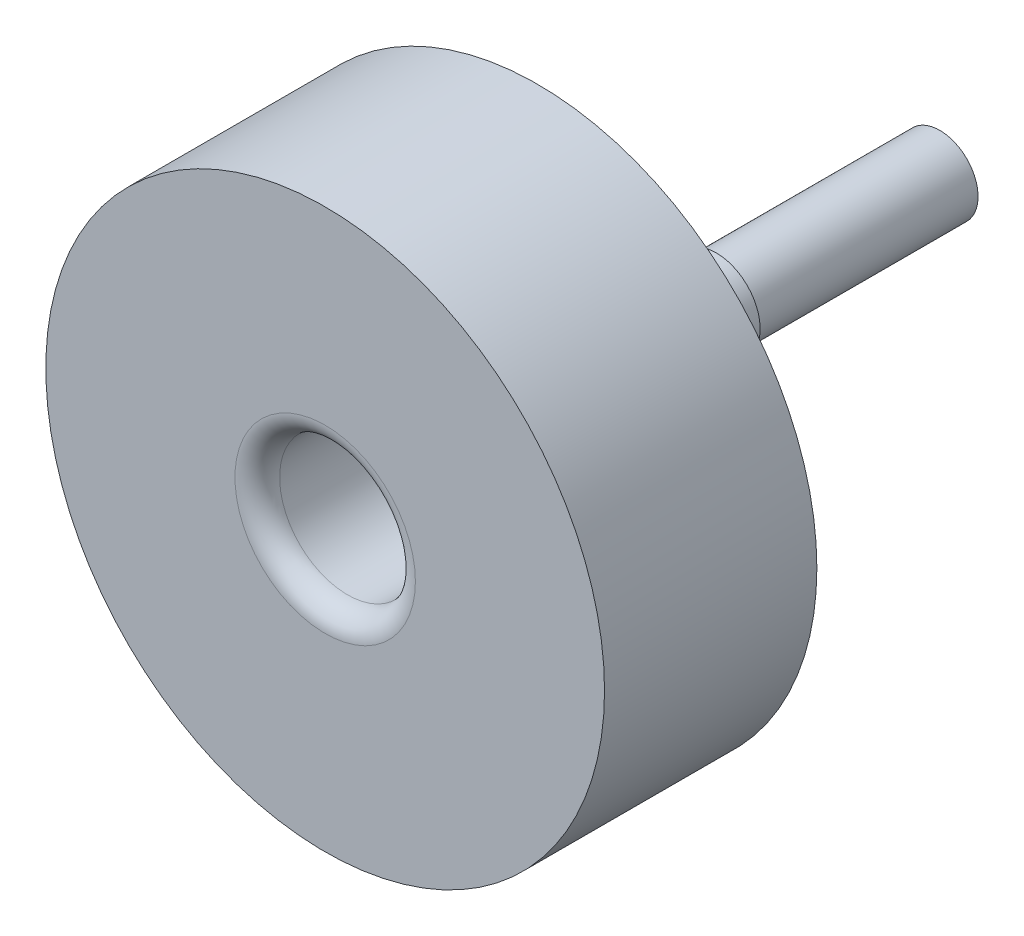
from build123d import *

# Parameters (mm, degrees)
SKIZZE1_R                       = 6
AUFSATZ_LINEAR_AUSTRAGEN1_DEPTH = 9
SKIZZE2_R                       = 3.925
AUFSATZ_LINEAR_AUSTRAGEN2_DEPTH = 7
SKIZZE3_R                       = 25
AUFSATZ_LINEAR_AUSTRAGEN3_DEPTH = 19
SKIZZE4_R                       = 6.075
SCHNITT_LINEAR_AUSTRAGEN2_DEPTH = 10
VERRUNDUNG1_R                   = 2
SKIZZE5_R                       = 3.425
AUFSATZ_LINEAR_AUSTRAGEN4_DEPTH = 20


with BuildPart() as part:
    # Skizze1 → Aufsatz-Linear austragen1 (new body)
    with BuildSketch(Plane.XY):
        Circle(SKIZZE1_R)
    extrude(amount=AUFSATZ_LINEAR_AUSTRAGEN1_DEPTH)

    # Skizze2 → Aufsatz-Linear austragen2 (add)
    with BuildSketch(Plane(origin=(0, 0, 0), x_dir=(-1, 0, 0), z_dir=(0, 0, -1))):
        Circle(SKIZZE2_R)
    extrude(amount=AUFSATZ_LINEAR_AUSTRAGEN2_DEPTH)

    # Skizze3 → Aufsatz-Linear austragen3 (add)
    with BuildSketch(Plane.XY.offset(9)):
        Circle(SKIZZE3_R)
    extrude(amount=AUFSATZ_LINEAR_AUSTRAGEN3_DEPTH)

    # Skizze4 → Schnitt-Linear austragen2 (cut)
    with BuildSketch(Plane.XY.offset(28)):
        Circle(SKIZZE4_R)
    extrude(amount=-SCHNITT_LINEAR_AUSTRAGEN2_DEPTH, mode=Mode.SUBTRACT)

    # Verrundung1
    verrundung1_edges = [part.edges().sort_by_distance(p)[0] for p in [
        (-6.075, 0, 28),
    ]]
    fillet(verrundung1_edges, radius=VERRUNDUNG1_R)

    # Skizze5 → Aufsatz-Linear austragen4 (add)
    with BuildSketch(Plane(origin=(0, 0, -7), x_dir=(-1, 0, 0), z_dir=(0, 0, -1))):
        Circle(SKIZZE5_R)
    extrude(amount=AUFSATZ_LINEAR_AUSTRAGEN4_DEPTH)


solid = part.part
